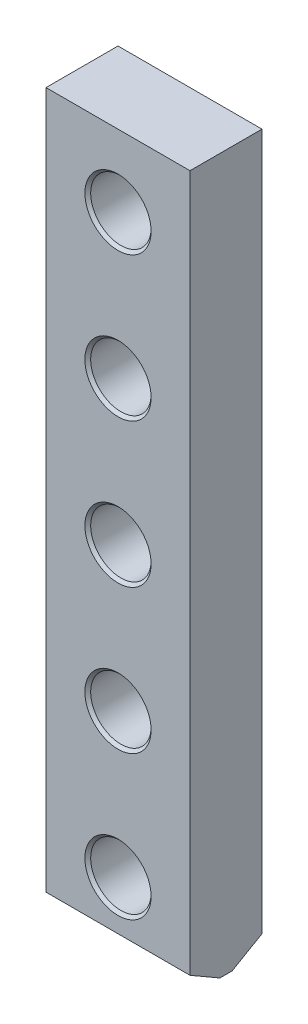
from build123d import *

# Parameters (mm, degrees)
SKETCH_1_W          = 50
SKETCH_1_H          = 248
EXTRUDE_1_DEPTH     = 25
SKETCH_2_R          = 10.5
CUT_EXTRUDE_1_DEPTH = 255.222343629
CHAMFER_1_SIZE      = 6
CHAMFER_1_SIZE2     = 10.392304845
CHAMFER_2_SIZE      = 6
CHAMFER_2_SIZE2     = 10.392304845
CHAMFER_3_SIZE      = 1


with BuildPart() as part:
    # Эскиз1 → Бобышка-Вытянуть1 (new body)
    with BuildSketch(Plane.XY):
        with Locations((25, 124)):
            Rectangle(SKETCH_1_W, SKETCH_1_H)
    extrude(amount=EXTRUDE_1_DEPTH)

    # Эскиз2 → Вырез-Вытянуть1 (cut, through all)
    with BuildSketch(Plane.XY.offset(25)):
        with Locations((25, 23)):
            Circle(SKETCH_2_R)
        with Locations((25, 73)):
            Circle(SKETCH_2_R)
        with Locations((25, 123)):
            Circle(SKETCH_2_R)
        with Locations((25, 173)):
            Circle(SKETCH_2_R)
        with Locations((25, 223)):
            Circle(SKETCH_2_R)
    extrude(amount=-CUT_EXTRUDE_1_DEPTH, mode=Mode.SUBTRACT)

    # Фаска1
    chamfer_1_edges = [part.edges().sort_by_distance(p)[0] for p in [
        (25, 0, 0),
    ]]
    chamfer_1_side = [part.faces().sort_by_distance(p)[0] for p in [
        (25, 2.529901184, 0),
    ]]
    chamfer(chamfer_1_edges, length=CHAMFER_1_SIZE, length2=CHAMFER_1_SIZE2, reference=chamfer_1_side[0])

    # Фаска2
    chamfer_2_edges = [part.edges().sort_by_distance(p)[0] for p in [
        (25, 0, 25),
    ]]
    chamfer_2_side = [part.faces().sort_by_distance(p)[0] for p in [
        (25, 2.529901184, 25),
    ]]
    chamfer(chamfer_2_edges, length=CHAMFER_2_SIZE, length2=CHAMFER_2_SIZE2, reference=chamfer_2_side[0])

    # Фаска3
    chamfer_3_edges = [part.edges().sort_by_distance(p)[0] for p in [
        (14.5, 223, 0),
        (14.5, 23, 0),
        (14.5, 73, 0),
        (14.5, 123, 0),
        (14.5, 173, 0),
        (14.5, 23, 25),
        (14.5, 73, 25),
        (14.5, 223, 25),
        (14.5, 173, 25),
        (14.5, 123, 25),
    ]]
    chamfer(chamfer_3_edges, length=CHAMFER_3_SIZE)


solid = part.part
